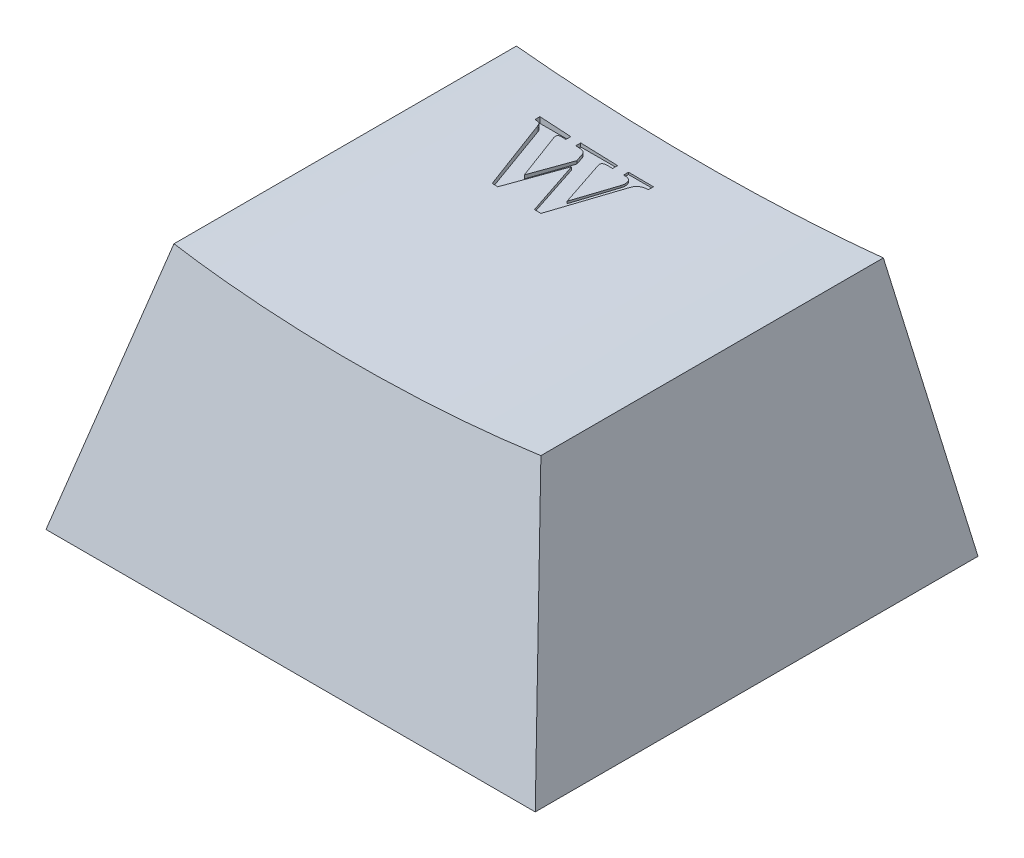
from build123d import *

# Parameters (mm, degrees)
SHELL1_T                = -1.2
SKETCH5_W               = 1.35
SKETCH5_H               = 5.256968873
SKETCH5_H_2             = 1.35
SKETCH5_W_2             = 5.491330354
SKETCH5_W_3             = 5.273072972
SKETCH5_H_3             = 5.618351113
BOSS_EXTRUDE1_DEPTH     = 4
SKETCH6_R               = 2.5
BOSS_EXTRUDE2_DEPTH     = 10
CUT_EXTRUDE3_DEPTH      = 10
CUT_EXTRUDE3_DEPTH_BACK = 10
CUT_EXTRUDE4_DEPTH      = 0.5


with BuildPart() as part:
    # Loft1: read off the stored shape, not the designer's step
    # Loft1: loft between two sections, ruled curve by curve
    loft1_from = [
        Edge.make_line((-10, 0, 9.05), (-10, 0, -9.05)),
        Edge.make_line((-10, 0, -9.05), (10, 0, -9.05)),
        Edge.make_line((10, 0, 9.05), (-10, 0, 9.05)),
        Edge.make_line((10, 0, -9.05), (10, 0, 9.05)),
    ]
    loft1_to = [
        Edge.make_line((-7.5, 10, 6.318777005), (-7.5, 10, -7.681222995)),
        Edge.make_line((-7.5, 10, -7.681222995), (7.5, 10, -7.681222995)),
        Edge.make_line((7.5, 10, 6.318777005), (-7.5, 10, 6.318777005)),
        Edge.make_line((7.5, 10, -7.681222995), (7.5, 10, 6.318777005)),
    ]
    loft1 = Solid(Shell([*[Face.make_surface_from_curves(loft1_from[k], loft1_to[k]) for k in range(4)], Face(Wire(loft1_from)), Face(Wire(loft1_to))]))
    add(loft1)

    # Shell1
    shell1_openings = [part.faces().sort_by_distance(p)[0] for p in [
        (0, 0, 0),
    ]]
    offset(amount=SHELL1_T, openings=shell1_openings, kind=Kind.INTERSECTION)

    # Sketch5 → Boss-Extrude1 (add)
    with BuildSketch(Plane(origin=(0, 10, 0), x_dir=(1, 0, 0), z_dir=(0, 1, 0))):
        with Locations((0, -2.44038684)):
            Rectangle(SKETCH5_W, SKETCH5_H)
        with Locations((0, 0.863097596)):
            Rectangle(SKETCH5_W, SKETCH5_H_2)
        with Locations((3.420665177, 0.863097596)):
            Rectangle(SKETCH5_W_2, SKETCH5_H_2)
        with Locations((-3.311536486, 0.863097596)):
            Rectangle(SKETCH5_W_3, SKETCH5_H_2)
        with Locations((0, 4.347273152)):
            Rectangle(SKETCH5_W, SKETCH5_H_3)
    extrude(amount=-BOSS_EXTRUDE1_DEPTH)

    # Sketch6 → Boss-Extrude2 (add)
    with BuildSketch(Plane(origin=(0, 10, 0), x_dir=(1, 0, 0), z_dir=(0, 1, 0))):
        with Locations(Location((0, 0.829201721, 0), (0, 0, 270))):
            Circle(SKETCH6_R)
        Polygon((-0.675, 2.913097596), (-0.675, 1.538097596), (-2.05, 1.538097596), (-2.05, 0.188097596), (-0.675, 0.188097596), (-0.675, -1.186902404), (0.675, -1.186902404), (0.675, 0.188097596), (2.05, 0.188097596), (2.05, 1.538097596), (0.675, 1.538097596), (0.675, 2.913097596), align=None, mode=Mode.SUBTRACT)
    extrude(amount=-BOSS_EXTRUDE2_DEPTH)

    # Sketch4 → Cut-Extrude3 (cut, two sides: drawn at the far end of the back side and taken through both)
    with BuildSketch(Plane.XY.offset(-CUT_EXTRUDE3_DEPTH_BACK)):
        with BuildLine():
            Line((-7.5, 10), (7.5, 10))
            add(Edge.make_bspline(
                [(-7.5, 10), (-3.102300298, 9.460265696), (2.493912061, 9.41154423), (7.5, 10)],
                knots=[0, 0, 0, 0, 1, 1, 1, 1], degree=3))
        make_face()
    extrude(amount=CUT_EXTRUDE3_DEPTH + CUT_EXTRUDE3_DEPTH_BACK, mode=Mode.SUBTRACT)

    # Sketch7 → Cut-Extrude4 (cut)
    with BuildSketch(Plane(origin=(0, 10, 0), x_dir=(1, 0, 0), z_dir=(0, 1, 0))):
        with BuildLine():
            Line((-4.780864366, 5.922144036), (-3.519005391, 5.922144036))
            Line((-3.519005391, 5.922144036), (-3.519005391, 5.718618395))
            Line((-3.519005391, 5.718618395), (-3.637940688, 5.718618395))
            add(Edge.make_bspline(
                [(-3.637940688, 5.718618395), (-3.655135293, 5.718298675), (-3.686433195, 5.717716715), (-3.729006145, 5.712612802), (-3.763096016, 5.705393375), (-3.78881293, 5.692977812), (-3.8070942, 5.676915533), (-3.819447693, 5.657684085), (-3.827587368, 5.635286205), (-3.828346031, 5.619053057), (-3.828745976, 5.610495398)],
                knots=[0, 0, 0, 0, 1.655695587, 3.013724266, 4.12842979, 4.996263288, 5.734172721, 6.442363129, 7.178857587, 8, 8, 8, 8], degree=3))
            add(Edge.make_bspline(
                [(-3.828745976, 5.610495398), (-3.827935202, 5.596638054), (-3.8261785, 5.566613383), (-3.81792552, 5.537672623), (-3.813481553, 5.522088947)],
                knots=[0, 0, 0, 0, 0.92306383, 2, 2, 2, 2], degree=3))
            Line((-3.813481553, 5.522088947), (-3.132306673, 3.635660662))
            Line((-3.132306673, 3.635660662), (-2.586603548, 5.238425085))
            Line((-2.586603548, 5.238425085), (-2.691546457, 5.556433899))
            add(Edge.make_bspline(
                [(-2.691546457, 5.556433899), (-2.696705028, 5.569949091), (-2.7064075, 5.595369072), (-2.725520717, 5.629084688), (-2.747885349, 5.656076509), (-2.765681383, 5.669109501), (-2.774228749, 5.675369196)],
                knots=[0, 0, 0, 0, 1.175505941, 2.210944564, 3.140723652, 4, 4, 4, 4], degree=3))
            add(Edge.make_bspline(
                [(-2.774228749, 5.675369196), (-2.786526434, 5.682223978), (-2.812224647, 5.696548271), (-2.856749443, 5.708822147), (-2.906166524, 5.717600207), (-2.941028957, 5.718268145), (-2.959309879, 5.718618395)],
                knots=[0, 0, 0, 0, 0.875237679, 1.828965724, 2.861568027, 4, 4, 4, 4], degree=3))
            Line((-2.959309879, 5.718618395), (-3.111954109, 5.718618395))
            Line((-3.111954109, 5.718618395), (-3.111954109, 5.922144036))
            Line((-3.111954109, 5.922144036), (-1.605864366, 5.922144036))
            Line((-1.605864366, 5.922144036), (-1.605864366, 5.718618395))
            Line((-1.605864366, 5.718618395), (-1.747696297, 5.718618395))
            add(Edge.make_bspline(
                [(-1.747696297, 5.718618395), (-1.771456323, 5.718378199), (-1.814841431, 5.717939609), (-1.873911631, 5.711930572), (-1.920702063, 5.701790817), (-1.956628554, 5.687304501), (-1.982034107, 5.667479747), (-1.999396203, 5.643840507), (-2.011010812, 5.616593715), (-2.011847895, 5.596625547), (-2.01227963, 5.586326728)],
                knots=[0, 0, 0, 0, 1.714148818, 3.129985267, 4.276727023, 5.160657128, 5.901376261, 6.568437672, 7.261654719, 8, 8, 8, 8], degree=3))
            add(Edge.make_bspline(
                [(-2.01227963, 5.586326728), (-2.011825699, 5.576716145), (-2.010872101, 5.556526669), (-2.004700913, 5.537268169), (-2.001467331, 5.527177089)],
                knots=[0, 0, 0, 0, 0.952038799, 2, 2, 2, 2], degree=3))
            Line((-2.001467331, 5.527177089), (-1.381986161, 3.635660662))
            Line((-1.381986161, 3.635660662), (-0.8458233, 5.297574725))
            add(Edge.make_bspline(
                [(-0.8458233, 5.297574725), (-0.838138315, 5.322184666), (-0.82318736, 5.370062717), (-0.820871874, 5.420152039), (-0.819746577, 5.444494797)],
                knots=[0, 0, 0, 0, 1.028026033, 2, 2, 2, 2], degree=3))
            add(Edge.make_bspline(
                [(-0.819746577, 5.444494797), (-0.820535966, 5.465347045), (-0.822026939, 5.50473212), (-0.834869187, 5.560235902), (-0.856422532, 5.608480656), (-0.887535554, 5.648134893), (-0.924858201, 5.68006508), (-0.968418499, 5.702501412), (-1.017345761, 5.71638575), (-1.051795947, 5.717854835), (-1.069701505, 5.718618395)],
                knots=[0, 0, 0, 0, 1.192510613, 2.252376767, 3.240823701, 4.19251923, 5.11409438, 6.031584123, 6.976911646, 8, 8, 8, 8], degree=3))
            Line((-1.069701505, 5.718618395), (-1.158107956, 5.718618395))
            Line((-1.158107956, 5.718618395), (-1.158107956, 5.922144036))
            Line((-1.158107956, 5.922144036), (-0.14047975, 5.922144036))
            Line((-0.14047975, 5.922144036), (-0.14047975, 5.718618395))
            add(Edge.make_bspline(
                [(-0.14047975, 5.718618395), (-0.17000843, 5.716943894), (-0.226076597, 5.713764403), (-0.305801986, 5.6989593), (-0.375631822, 5.673331733), (-0.436896235, 5.639267674), (-0.489536795, 5.595758006), (-0.533856822, 5.542629255), (-0.570593733, 5.479973415), (-0.588077676, 5.433567924), (-0.597140407, 5.409513827)],
                knots=[0, 0, 0, 0, 1.193473395, 2.266131314, 3.259941233, 4.183600984, 5.083354208, 6.00064656, 6.963643304, 8, 8, 8, 8], degree=3))
            Line((-0.597140407, 5.409513827), (-1.482476946, 2.665733779))
            Line((-1.482476946, 2.665733779), (-1.745788244, 2.665733779))
            Line((-1.745788244, 2.665733779), (-2.482296657, 4.917236183))
            Line((-2.482296657, 4.917236183), (-3.249333917, 2.665733779))
            Line((-3.249333917, 2.665733779), (-3.471940087, 2.665733779))
            Line((-3.471940087, 2.665733779), (-4.515008997, 5.556433899))
            add(Edge.make_bspline(
                [(-4.515008997, 5.556433899), (-4.51937065, 5.570536793), (-4.527519997, 5.596886752), (-4.543498142, 5.632455097), (-4.561438603, 5.66146931), (-4.582786932, 5.683346509), (-4.606156722, 5.69999819), (-4.632897529, 5.710346771), (-4.662128217, 5.718097638), (-4.682858161, 5.718439241), (-4.693729951, 5.718618395)],
                knots=[0, 0, 0, 0, 1.34073981, 2.505048815, 3.536764225, 4.422637444, 5.267304403, 6.122676221, 7.015440249, 8, 8, 8, 8], degree=3))
            Line((-4.693729951, 5.718618395), (-4.780864366, 5.718618395))
            Line((-4.780864366, 5.718618395), (-4.780864366, 5.922144036))
        make_face()
    extrude(amount=-CUT_EXTRUDE4_DEPTH, mode=Mode.SUBTRACT)


solid = part.part
